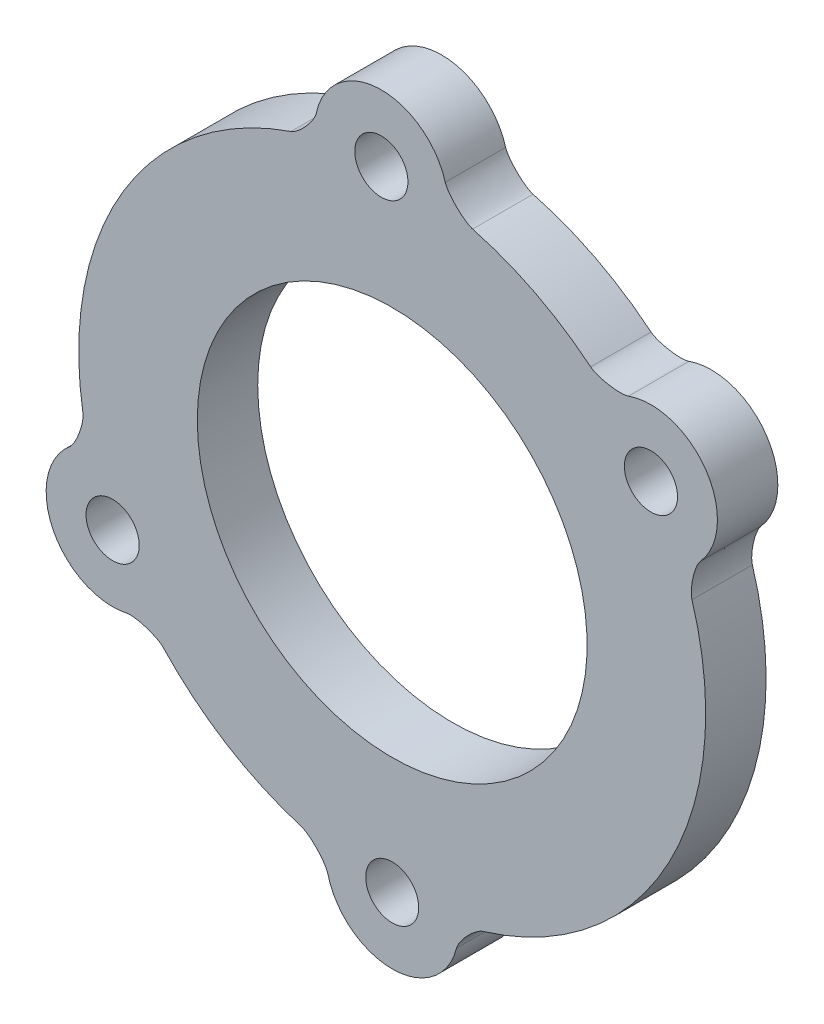
from build123d import *

# Parameters (mm, degrees)
BOSS_EXTRUDE1_DEPTH = 7.77


with BuildPart() as part:
    # Sketch1 → Boss-Extrude1 (new body)
    # profile 1 of 5: a face of its own
    with BuildSketch(Plane.XY):
        with BuildLine():
            ThreePointArc((3.404182759, -40.079440399), (3.403839221, -40.127801725), (3.402808675, -40.176153289))
            ThreePointArc((3.402808675, -40.176153289), (5.967670482, -39.875923927), (8.508052822, -39.412122972))
            ThreePointArc((8.508052822, -39.412122972), (35.574552979, -18.977712726), (37.472579791, 14.883150333))
            ThreePointArc((37.472579791, 14.883150333), (36.442962914, 17.251459476), (35.263848757, 19.548999228))
            ThreePointArc((35.263848757, 19.548999228), (30.43912953, 20.428209113), (31.453728524, 25.226283157))
            ThreePointArc((31.453728524, 25.226283157), (29.774333348, 27.188075947), (27.972797119, 29.038337096))
            ThreePointArc((27.972797119, 29.038337096), (18.347193458, 35.903800526), (7.14399719, 39.682057711))
            ThreePointArc((7.14399719, 39.682057711), (4.589484945, 40.057945878), (2.016151733, 40.269560864))
            ThreePointArc((2.016151733, 40.269560864), (2.020874049, 40.165888855), (2.022448638, 40.062121295))
            ThreePointArc((2.022448638, 40.062121295), (-1.382077907, 36.642156299), (-4.817411346, 40.031174701))
            ThreePointArc((-4.817411346, 40.031174701), (-7.369742742, 39.640752918), (-9.891851642, 39.087768817))
            ThreePointArc((-9.891851642, 39.087768817), (-34.597565404, 20.705334291), (-39.122221714, -9.7546998))
            ThreePointArc((-39.122221714, -9.7546998), (-38.417536694, -12.239087971), (-37.555259765, -14.673270392))
            ThreePointArc((-37.555259765, -14.673270392), (-34.193471955, -14.769982316), (-32.539881663, -17.698567233))
            ThreePointArc((-32.539881663, -17.698567233), (-33.081813677, -19.546068243), (-34.535867272, -20.808081887))
            ThreePointArc((-34.535867272, -20.808081887), (-33.133010631, -22.976205225), (-31.594239644, -25.05007827))
            ThreePointArc((-31.594239644, -25.05007827), (-21.298252211, -34.235754012), (-8.508052822, -39.412122972))
            ThreePointArc((-8.508052822, -39.412122972), (-5.967670482, -39.875923927), (-3.402808675, -40.176153289))
            ThreePointArc((-3.402808675, -40.176153289), (-0.048361325, -36.675601178), (3.404182759, -40.079440399))
        make_face()
        with BuildLine():
            ThreePointArc((-22.494419384, -11.066975129), (-5.681299846, 24.417200372), (25.069440399, 0))
            ThreePointArc((25.069440399, 0), (5.681299846, -24.417200372), (-22.494419384, -11.066975129))
        make_face(mode=Mode.SUBTRACT)
    # profile 2 of 5: a face of its own
    with BuildSketch(Plane.XY):
        with BuildLine():
            ThreePointArc((35.263848757, 19.548999228), (36.442962914, 17.251459476), (37.472579791, 14.883150333))
            ThreePointArc((37.472579791, 14.883150333), (40.378310636, 27.098559849), (27.972797119, 29.038337096))
            ThreePointArc((27.972797119, 29.038337096), (29.774333348, 27.188075947), (31.453728524, 25.226283157))
            ThreePointArc((31.453728524, 25.226283157), (34.9303084, 25.328891825), (36.69889556, 22.334023609))
            ThreePointArc((36.69889556, 22.334023609), (36.319038644, 20.767521125), (35.263848757, 19.548999228))
        make_face()
    # profile 3 of 5: a face of its own
    with BuildSketch(Plane.XY):
        with BuildLine():
            ThreePointArc((2.016151733, 40.269560864), (4.589484945, 40.057945878), (7.14399719, 39.682057711))
            ThreePointArc((7.14399719, 39.682057711), (-1.695633435, 48.606923637), (-9.891851642, 39.087768817))
            ThreePointArc((-9.891851642, 39.087768817), (-7.369742742, 39.640752918), (-4.817411346, 40.031174701))
            ThreePointArc((-4.817411346, 40.031174701), (-1.516784191, 43.480042232), (2.016151733, 40.269560864))
        make_face()
    # profile 4 of 5: a face of its own
    with BuildSketch(Plane.XY):
        with BuildLine():
            ThreePointArc((-39.122221714, -9.7546998), (-43.631335255, -21.474193014), (-31.594239644, -25.05007827))
            ThreePointArc((-31.594239644, -25.05007827), (-33.133010631, -22.976205225), (-34.535867272, -20.808081887))
            ThreePointArc((-34.535867272, -20.808081887), (-39.028605211, -19.208850623), (-37.555259765, -14.673270392))
            ThreePointArc((-37.555259765, -14.673270392), (-38.417536694, -12.239087971), (-39.122221714, -9.7546998))
        make_face()
    # profile 5 of 5: a face of its own
    with BuildSketch(Plane.XY):
        with BuildLine():
            ThreePointArc((8.508052822, -39.412122972), (5.967670482, -39.875923927), (3.402808675, -40.176153289))
            ThreePointArc((3.402808675, -40.176153289), (0, -43.483623159), (-3.402808675, -40.176153289))
            ThreePointArc((-3.402808675, -40.176153289), (-5.967670482, -39.875923927), (-8.508052822, -39.412122972))
            ThreePointArc((-8.508052822, -39.412122972), (0, -48.613623159), (8.508052822, -39.412122972))
        make_face()
    extrude(amount=BOSS_EXTRUDE1_DEPTH)

    # Fillet1
    # a fillet whose section is not a circle: 5 mm, written as the material it adds along each edge (its section moved 0.00015 mm through the faces so that the kernel can cut it)
    with BuildSketch(Plane(origin=(27.972797119, 29.038337096, 0), x_dir=(-0.7478052572443031, 0.6639181404644565, 0), z_dir=(0, 0, 1))) as fillet1_piece_1:
        with BuildLine():
            Bezier((3.27455803, 0), (0.443727696, -0.114917188), (-0.912581333, -2.602331942), weights=[1, 0.435020662, 1])
            Line((-0.912581333, -2.602331942), (-1.000377754, -2.554459315))
            ThreePointArc((-1.000377754, -2.554459315), (-0.444974343, -1.30513366), (-0.098468347, 0.017435156))
            Line((-0.098468347, 0.017435156), (0.004065293, 0.099917333))
            ThreePointArc((0.004065293, 0.099917333), (1.637282071, 0.066668632), (3.270501884, 0.099917705))
            Line((3.270501884, 0.099917705), (3.27455803, 0))
        make_face()
    extrude(amount=7.77)
    with BuildSketch(Plane(origin=(37.472579791, 14.883150333, 0), x_dir=(0.7809050051368507, 0.62464980024988, 0), z_dir=(0, 0, 1))) as fillet1_piece_2:
        with BuildLine():
            Bezier((2.757704884, 0), (-0.038396039, -0.456755922), (-1.083618682, -3.090064861), weights=[1, 0.435020662, 1])
            Line((-1.083618682, -3.090064861), (-1.176564622, -3.053172417))
            ThreePointArc((-1.176564622, -3.053172417), (-0.604722781, -1.522973292), (-0.09563314, 0.029228455))
            Line((-0.09563314, 0.029228455), (0.016132368, 0.098690155))
            ThreePointArc((0.016132368, 0.098690155), (1.378851781, -0.011991736), (2.741583111, 0.098691886))
            Line((2.741583111, 0.098691886), (2.757704884, 0))
        make_face()
    extrude(amount=7.77)
    with BuildSketch(Plane(origin=(-9.891851642, 39.087768817, 0), x_dir=(-0.9586545512733944, -0.2845724008452099, 0), z_dir=(0, 0, 1))) as fillet1_piece_3:
        with BuildLine():
            Bezier((3.277172257, 0), (0.444362291, -0.115089718), (-0.911320112, -2.605106418), weights=[1, 0.434946583, 1])
            Line((-0.911320112, -2.605106418), (-0.999146838, -2.557289411))
            ThreePointArc((-0.999146838, -2.557289411), (-0.444170839, -1.306571665), (-0.0984839, 0.017347088))
            Line((-0.0984839, 0.017347088), (0.004068531, 0.099917201))
            ThreePointArc((0.004068531, 0.099917201), (1.63858918, 0.066615488), (3.273112865, 0.099917573))
            Line((3.273112865, 0.099917573), (3.277172257, 0))
        make_face()
    extrude(amount=7.77)
    with BuildSketch(Plane(origin=(7.14399719, 39.682057711, 0), x_dir=(-0.11742410292813261, 0.9930818596931088, 0), z_dir=(0, 0, 1))) as fillet1_piece_4:
        with BuildLine():
            Bezier((2.759906483, 0), (-0.038093802, -0.45744109), (-1.082121081, -3.093359334), weights=[1, 0.434946583, 1])
            Line((-1.082121081, -3.093359334), (-1.175093979, -3.056534883))
            ThreePointArc((-1.175093979, -3.056534883), (-0.603940648, -1.524686137), (-0.095656384, 0.029152292))
            Line((-0.095656384, 0.029152292), (0.016145239, 0.09868805))
            ThreePointArc((0.016145239, 0.09868805), (1.379952571, -0.012171692), (2.743771831, 0.098689782))
            Line((2.743771831, 0.098689782), (2.759906483, 0))
        make_face()
    extrude(amount=7.77)
    with BuildSketch(Plane(origin=(-39.122221714, -9.7546998, 0), x_dir=(-0.8572531161014109, -0.5148952271427859, 0), z_dir=(0, 0, 1))) as fillet1_piece_5:
        with BuildLine():
            Bezier((2.757951127, 0), (-0.038361657, -0.456825585), (-1.083457749, -3.090421787), weights=[1, 0.435012441, 1])
            Line((-1.083457749, -3.090421787), (-1.176406599, -3.053536679))
            ThreePointArc((-1.176406599, -3.053536679), (-0.604638694, -1.523158848), (-0.095635652, 0.029220234))
            Line((-0.095635652, 0.029220234), (0.016133572, 0.098689958))
            ThreePointArc((0.016133572, 0.098689958), (1.378974902, -0.012010201), (2.741828149, 0.09869169))
            Line((2.741828149, 0.09869169), (2.757951127, 0))
        make_face()
    extrude(amount=7.77)
    with BuildSketch(Plane(origin=(-31.594239644, -25.05007827, 0), x_dir=(-0.9309287843318478, -0.36520076465203083, 0), z_dir=(0, 0, 1))) as fillet1_piece_6:
        with BuildLine():
            Bezier((2.757951127, 0), (-0.038361657, 0.456825585), (-1.083457749, 3.090421787), weights=[1, 0.435012441, 1])
            Line((-1.083457749, 3.090421787), (-1.176406599, 3.053536679))
            ThreePointArc((-1.176406599, 3.053536679), (-0.604638694, 1.523158848), (-0.095635652, -0.029220234))
            Line((-0.095635652, -0.029220234), (0.016133572, -0.098689958))
            ThreePointArc((0.016133572, -0.098689958), (1.378974902, 0.012010201), (2.741828149, -0.09869169))
            Line((2.741828149, -0.09869169), (2.757951127, 0))
        make_face()
    extrude(amount=7.77)
    with BuildSketch(Plane(origin=(-8.508052822, -39.412122972, 0), x_dir=(0.08389843348969565, -0.9964743111881886, 0), z_dir=(0, 0, 1))) as fillet1_piece_7:
        with BuildLine():
            Bezier((2.756625198, 0), (-0.038622025, -0.457301683), (-1.083539201, -3.089920144), weights=[1, 0.435048815, 1])
            Line((-1.083539201, -3.089920144), (-1.17648552, -3.053028659))
            ThreePointArc((-1.17648552, -3.053028659), (-0.604686345, -1.522900359), (-0.095633323, 0.029227856))
            Line((-0.095633323, 0.029227856), (0.016155935, 0.0986863))
            ThreePointArc((0.016155935, 0.0986863), (1.378311931, -0.012113558), (2.740479863, 0.098688034))
            Line((2.740479863, 0.098688034), (2.756625198, 0))
        make_face()
    extrude(amount=7.77)
    with BuildSketch(Plane(origin=(8.508052822, -39.412122972, 0), x_dir=(0.968097352048771, 0.25057437410109984, 0), z_dir=(0, 0, 1))) as fillet1_piece_8:
        with BuildLine():
            Bezier((3.274395165, 0), (0.444318442, -0.114880859), (-0.912202503, -2.601320641), weights=[1, 0.435048815, 1])
            Line((-0.912202503, -2.601320641), (-0.999987888, -2.553427781))
            ThreePointArc((-0.999987888, -2.553427781), (-0.444669934, -1.304668221), (-0.098472652, 0.017410827))
            Line((-0.098472652, 0.017410827), (0.004065091, 0.099917341))
            ThreePointArc((0.004065091, 0.099917341), (1.637200639, 0.066671941), (3.270339221, 0.099917713))
            Line((3.270339221, 0.099917713), (3.274395165, 0))
        make_face()
    extrude(amount=7.77)


solid = part.part
